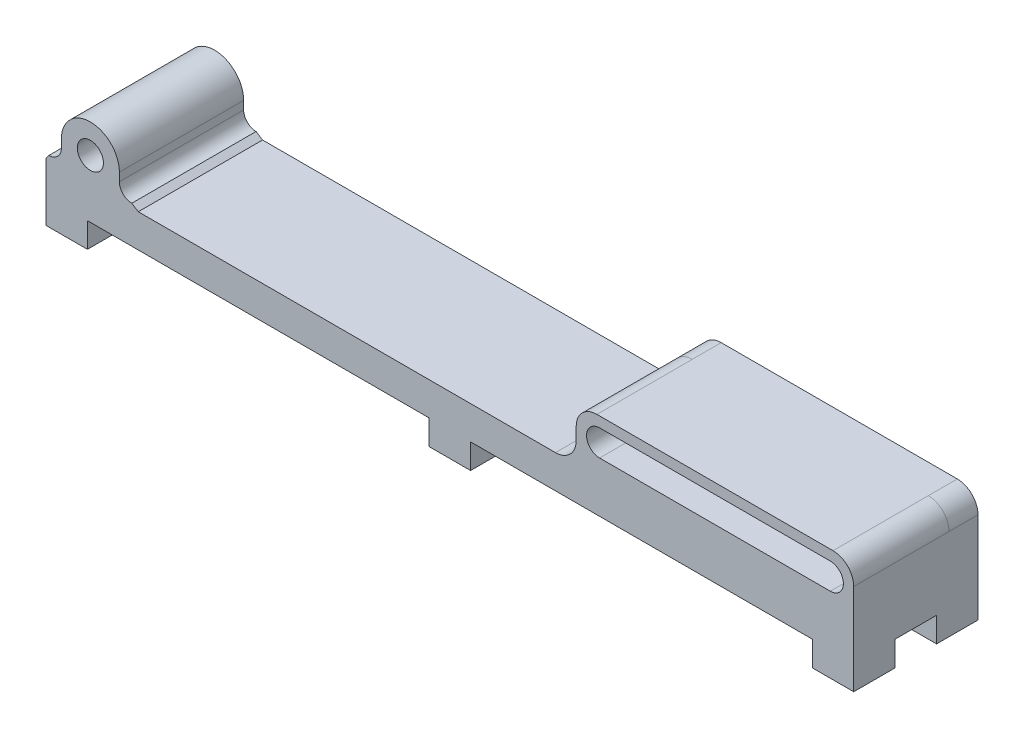
from build123d import *

# Parameters (mm, degrees)
SKETCH1_W           = 195
SKETCH1_H           = 30
BOSS_EXTRUDE1_DEPTH = 8
SKETCH2_W           = 12
SKETCH2_H           = 30
BOSS_EXTRUDE2_DEPTH = 12
SKETCH4_R           = 3.15
CUT_EXTRUDE1_DEPTH  = 199.305320151
FILLET1_R           = 4
FILLET2_R           = 6
BOSS_EXTRUDE4_DEPTH = 30
SKETCH15_W          = 67
SKETCH15_H          = 7
BOSS_EXTRUDE6_DEPTH = 13
SKETCH16_W          = 62
SKETCH16_H          = 6.3
CUT_EXTRUDE4_DEPTH  = 199.408669165
FILLET6_R           = 5
FILLET7_R           = 5
SKETCH17_W          = 10
SKETCH17_H          = 30
BOSS_EXTRUDE7_DEPTH = 6
FILLET8_R           = 3.15
FILLET9_R           = 5
SKETCH20_R          = 3.15
BOSS_EXTRUDE8_DEPTH = 16
SKETCH21_W          = 10
SKETCH21_H          = 30
BOSS_EXTRUDE9_DEPTH = 6
SKETCH22_W          = 10
SKETCH22_H          = 10
CUT_EXTRUDE5_DEPTH  = 6
FILLET10_R          = 5
FILLET11_R          = 3.15


with BuildPart() as part:
    # Sketch1 → Boss-Extrude1 (new body)
    with BuildSketch(Plane(origin=(0, 0, 0), x_dir=(1, 0, 0), z_dir=(0, 1, 0))):
        with Locations((97.5, 15)):
            Rectangle(SKETCH1_W, SKETCH1_H)
    extrude(amount=BOSS_EXTRUDE1_DEPTH)

    # Sketch2 → Boss-Extrude2 (add)
    with BuildSketch(Plane(origin=(0, 8, 0), x_dir=(1, 0, 0), z_dir=(0, 1, 0))):
        with Locations((10.715252385, 15)):
            Rectangle(SKETCH2_W, SKETCH2_H)
    extrude(amount=BOSS_EXTRUDE2_DEPTH)

    # Sketch4 → Cut-Extrude1 (cut, through all)
    with BuildSketch(Plane(origin=(0, 0, -30), x_dir=(-1, 0, 0), z_dir=(0, 0, -1))):
        with Locations((-10.715252385, 14)):
            Circle(SKETCH4_R)
    extrude(amount=-CUT_EXTRUDE1_DEPTH, mode=Mode.SUBTRACT)

    # Fillet1
    fillet1_edges = [part.edges().sort_by_distance(p)[0] for p in [
        (4.715252385, 8, -15),
        (16.715252385, 8, -15),
    ]]
    fillet(fillet1_edges, radius=FILLET1_R)

    # Fillet2
    fillet2_edges = [part.edges().sort_by_distance(p)[0] for p in [
        (4.715252385, 20, -15),
        (16.715252385, 20, -15),
    ]]
    fillet(fillet2_edges, radius=FILLET2_R - 0.0001)  # a hair under: the kernel refuses the full size

    # Sketch11 → Boss-Extrude4 (add)
    with BuildSketch(Plane(origin=(0, 0, -30), x_dir=(-1, 0, 0), z_dir=(0, 0, -1))):
        with BuildLine():
            Line((-16.715252385, 14), (-16.715252385, 12))
            ThreePointArc((-16.715252385, 12), (-17.88682526, 9.171572875), (-20.715252385, 8))
            Line((-20.715252385, 8), (-22.27876013, 8))
            Line((-22.27876013, 8), (-20.715252385, 9))
            ThreePointArc((-20.715252385, 9), (-18.593932042, 9.878679656), (-17.715252385, 12))
            Line((-17.715252385, 12), (-17.715252385, 14))
            ThreePointArc((-17.715252385, 14), (-15.664999853, 18.949747468), (-10.715252385, 21))
            ThreePointArc((-10.715252385, 21), (-5.765504917, 18.949747468), (-3.715252385, 14))
            Line((-3.715252385, 14), (-3.715252385, 12))
            ThreePointArc((-3.715252385, 12), (-2.836572729, 9.878679656), (-0.715252385, 9))
            Line((-0.715252385, 9), (0, 8))
            Line((0, 8), (-0.715252385, 8))
            ThreePointArc((-0.715252385, 8), (-3.54367951, 9.171572875), (-4.715252385, 12))
            Line((-4.715252385, 12), (-4.715252385, 14))
            ThreePointArc((-4.715252385, 14), (-6.472611698, 18.242640687), (-10.715252385, 20))
            ThreePointArc((-10.715252385, 20), (-14.957893072, 18.242640687), (-16.715252385, 14))
        make_face()
    extrude(amount=-BOSS_EXTRUDE4_DEPTH)

    # Sketch15 → Boss-Extrude6 (add)
    with BuildSketch(Plane(origin=(0, 8, 0), x_dir=(1, 0, 0), z_dir=(0, 1, 0))):
        with Locations((161.5, 26.5)):
            Rectangle(SKETCH15_W, SKETCH15_H)
        with Locations((161.5, 3.5)):
            Rectangle(SKETCH15_W, SKETCH15_H)
    extrude(amount=BOSS_EXTRUDE6_DEPTH)

    # Sketch16 → Cut-Extrude4 (cut, through all)
    with BuildSketch(Plane(origin=(0, 0, -30), x_dir=(-1, 0, 0), z_dir=(0, 0, -1))):
        with Locations((-161.5, 15.35)):
            Rectangle(SKETCH16_W, SKETCH16_H)
    extrude(amount=-CUT_EXTRUDE4_DEPTH, mode=Mode.SUBTRACT)

    # Fillet6
    fillet6_edges = [part.edges().sort_by_distance(p)[0] for p in [
        (195, 21, -26.5),
        (128, 21, -26.5),
    ]]
    fillet(fillet6_edges, radius=FILLET6_R)

    # Fillet7
    fillet7_edges = [part.edges().sort_by_distance(p)[0] for p in [
        (128, 8, -26.5),
    ]]
    fillet(fillet7_edges, radius=FILLET7_R)

    # Sketch17 → Boss-Extrude7 (add)
    with BuildSketch(Plane.XZ):
        with Locations((97.5, -15)):
            Rectangle(SKETCH17_W, SKETCH17_H)
    extrude(amount=BOSS_EXTRUDE7_DEPTH)

    # Fillet8
    fillet8_edges = [part.edges().sort_by_distance(p)[0] for p in [
        (192.5, 18.5, -3.5),
        (192.5, 12.2, -3.5),
        (130.5, 18.5, -3.5),
        (130.5, 12.2, -3.5),
    ]]
    fillet(fillet8_edges, radius=FILLET8_R - 0.0001)  # a hair under: the kernel refuses the full size

    # Fillet9
    fillet9_edges = [part.edges().sort_by_distance(p)[0] for p in [
        (128, 8, -3.5),
    ]]
    fillet(fillet9_edges, radius=FILLET9_R)

    # Sketch20 → Boss-Extrude8 (add)
    with BuildSketch(Plane.XY.offset(-23)):
        with BuildLine():
            Line((195, 0), (195, 21))
            Line((195, 21), (128, 21))
            Line((128, 21), (128, 13))
            ThreePointArc((128, 13), (126.535533906, 9.464466094), (123, 8))
            Line((123, 8), (22.27876013, 8))
            Line((22.27876013, 8), (20.715252385, 9))
            ThreePointArc((20.715252385, 9), (18.593932042, 9.878679656), (17.715252385, 12))
            Line((17.715252385, 12), (17.715252385, 14))
            ThreePointArc((17.715252385, 14), (10.715252385, 21), (3.715252385, 14))
            Line((3.715252385, 14), (3.715252385, 12))
            ThreePointArc((3.715252385, 12), (2.836572729, 9.878679656), (0.715252385, 9))
            Line((0.715252385, 9), (0, 8))
            Line((0, 8), (0, 0))
            Line((0, 0), (92.5, 0))
            Line((92.5, 0), (92.5, -6))
            Line((92.5, -6), (102.5, -6))
            Line((102.5, -6), (102.5, 0))
            Line((102.5, 0), (195, 0))
        make_face()
        with Locations(Location((10.715252385, 14, 0), (0, 0, 180))):
            Circle(SKETCH20_R, mode=Mode.SUBTRACT)
        with BuildLine():
            Line((133.65, 12.2), (189.35, 12.2))
            ThreePointArc((189.35, 12.2), (191.577386361, 13.122613639), (192.5, 15.35))
            ThreePointArc((192.5, 15.35), (191.577386361, 17.577386361), (189.35, 18.5))
            Line((189.35, 18.5), (133.65, 18.5))
            ThreePointArc((133.65, 18.5), (131.422613639, 17.577386361), (130.5, 15.35))
            ThreePointArc((130.5, 15.35), (131.422613639, 13.122613639), (133.65, 12.2))
        make_face(mode=Mode.SUBTRACT)
    extrude(amount=BOSS_EXTRUDE8_DEPTH)

    # Sketch21 → Boss-Extrude9 (add)
    with BuildSketch(Plane(origin=(0, 0, 0), x_dir=(-1, 0, 0), z_dir=(0, -1, 0))):
        with Locations((-5, 15)):
            Rectangle(SKETCH21_W, SKETCH21_H)
        with Locations((-190, 15)):
            Rectangle(SKETCH21_W, SKETCH21_H)
    extrude(amount=BOSS_EXTRUDE9_DEPTH)

    # Sketch22 → Cut-Extrude5 (cut)
    with BuildSketch(Plane(origin=(0, -6, 0), x_dir=(-1, 0, 0), z_dir=(0, -1, 0))):
        with Locations((-5, 15)):
            Rectangle(SKETCH22_W, SKETCH22_H)
        with Locations((-97.5, 15)):
            Rectangle(SKETCH22_W, SKETCH22_H)
        with Locations((-190, 15)):
            Rectangle(SKETCH22_W, SKETCH22_H)
    extrude(amount=-CUT_EXTRUDE5_DEPTH, mode=Mode.SUBTRACT)

    # Fillet10
    fillet10_edges = [part.edges().sort_by_distance(p)[0] for p in [
        (128, 21, -11.5),
        (195, 21, -11.5),
    ]]
    fillet(fillet10_edges, radius=FILLET10_R)

    # Fillet11
    fillet11_edges = [part.edges().sort_by_distance(p)[0] for p in [
        (130.5, 18.5, -26.5),
        (130.5, 12.2, -26.5),
        (192.5, 12.2, -26.5),
        (192.5, 18.5, -26.5),
    ]]
    fillet(fillet11_edges, radius=FILLET11_R - 0.0001)  # a hair under: the kernel refuses the full size


solid = part.part
